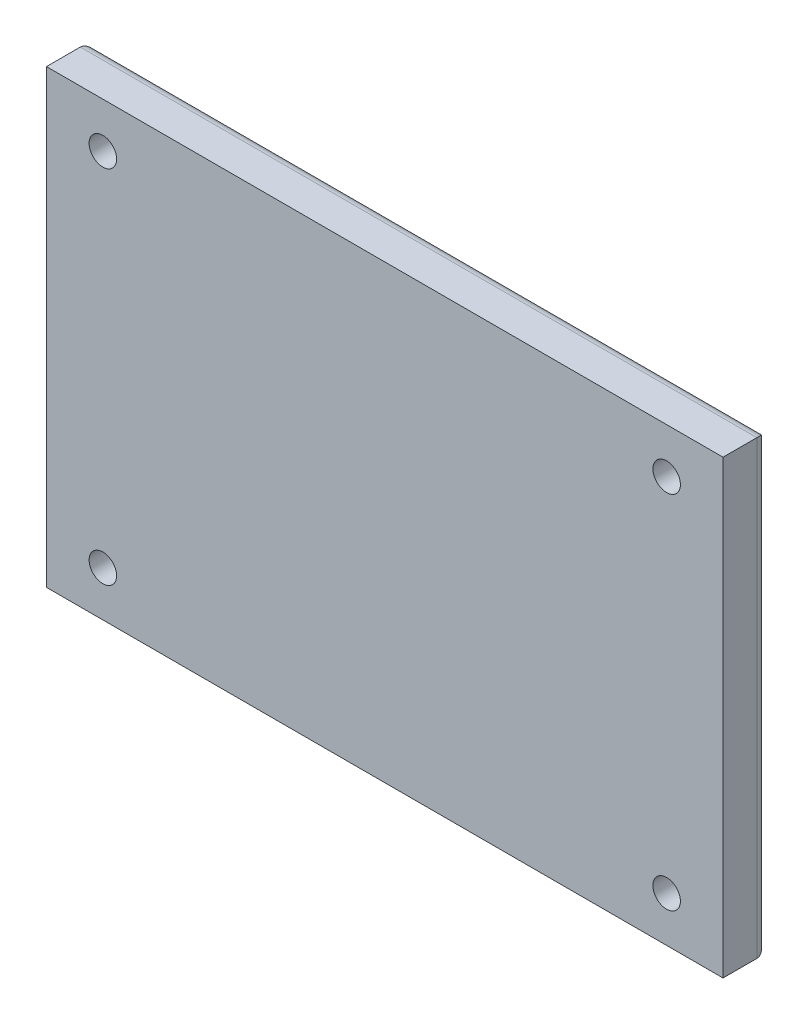
from build123d import *

# Parameters (mm, degrees)
SKETCH1_W                                      = 60
SKETCH1_H                                      = 40
BOSS_EXTRUDE1_DEPTH                            = 4
FILLET1_R                                      = 1
CBORE_FOR_2_SOCKET_HEAD_CAP_SCREW1_D           = 2.4384
CBORE_FOR_2_SOCKET_HEAD_CAP_SCREW1_DEPTH       = 15
CBORE_FOR_2_SOCKET_HEAD_CAP_SCREW1_CBORE_D     = 4.7625
CBORE_FOR_2_SOCKET_HEAD_CAP_SCREW1_CBORE_DEPTH = 2.1844
CBORE_FOR_2_SOCKET_HEAD_CAP_SCREW1_TIP         = 0.732569267


with BuildPart() as part:
    # Sketch1 → Boss-Extrude1 (new body)
    with BuildSketch(Plane.XY):
        Rectangle(SKETCH1_W, SKETCH1_H)
    extrude(amount=BOSS_EXTRUDE1_DEPTH)

    # Fillet1
    fillet1_edges = [part.edges().sort_by_distance(p)[0] for p in [
        (0, 20, 0),
        (-30, 0, 0),
        (0, -20, 0),
        (30, 0, 0),
    ]]
    fillet(fillet1_edges, radius=FILLET1_R)

    # CBORE for #2 Socket Head Cap Screw1
    with Locations(Plane(origin=(-25, -16, 0), x_dir=(-1, 0, 0), z_dir=(0, 0, -1))):
        with Locations((0, 0), (0, 32), (-50, 32), (-50, 0)):
            CounterBoreHole(CBORE_FOR_2_SOCKET_HEAD_CAP_SCREW1_D / 2, CBORE_FOR_2_SOCKET_HEAD_CAP_SCREW1_CBORE_D / 2, CBORE_FOR_2_SOCKET_HEAD_CAP_SCREW1_CBORE_DEPTH, depth=CBORE_FOR_2_SOCKET_HEAD_CAP_SCREW1_DEPTH)
            with Locations((0, 0, -(CBORE_FOR_2_SOCKET_HEAD_CAP_SCREW1_DEPTH + CBORE_FOR_2_SOCKET_HEAD_CAP_SCREW1_TIP / 2))):  # 118° drill point
                Cone(0, CBORE_FOR_2_SOCKET_HEAD_CAP_SCREW1_D / 2, CBORE_FOR_2_SOCKET_HEAD_CAP_SCREW1_TIP, mode=Mode.SUBTRACT)


solid = part.part
